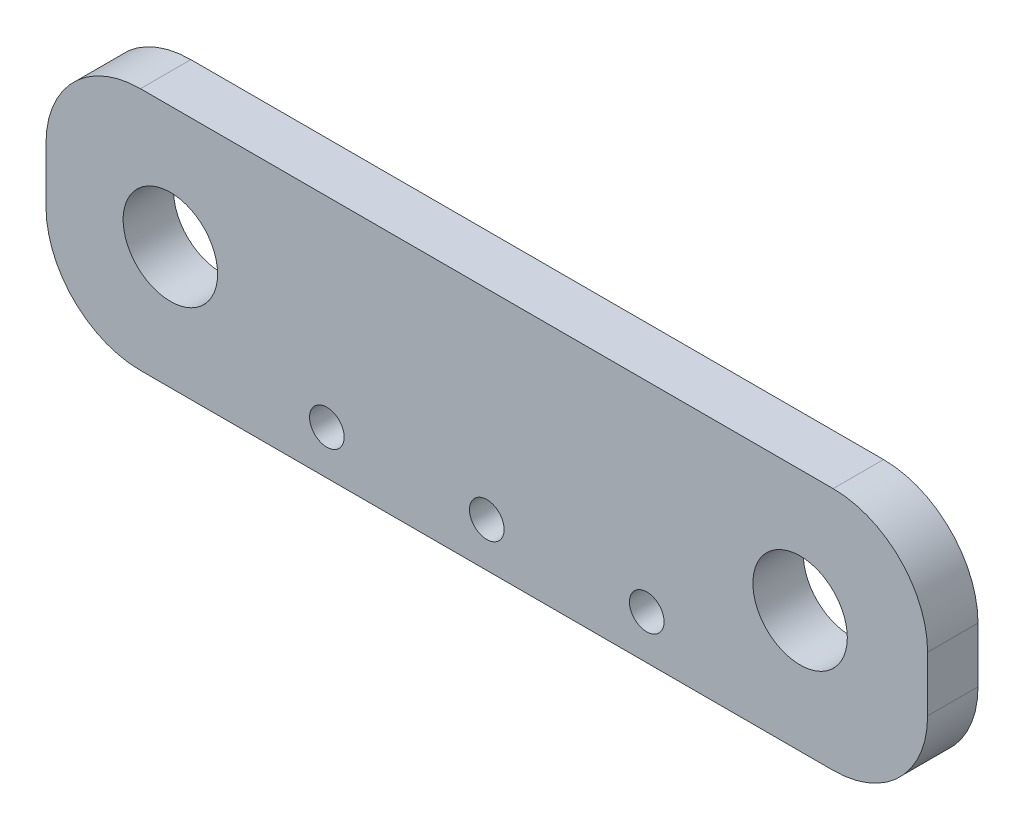
from build123d import *

# Parameters (mm, degrees)
SKETCH1_W           = 28
SKETCH1_H           = 7.75
BOSS_EXTRUDE1_DEPTH = 1.6
SKETCH2_R           = 1.5
CUT_EXTRUDE1_DEPTH  = 15.614226801
SKETCH3_R           = 0.55
CUT_EXTRUDE2_DEPTH  = 15.614226801
FILLET1_R           = 3


with BuildPart() as part:
    # Sketch1 → Boss-Extrude1 (new body)
    with BuildSketch(Plane.XY):
        Rectangle(SKETCH1_W, SKETCH1_H)
    extrude(amount=BOSS_EXTRUDE1_DEPTH)

    # Sketch2 → Cut-Extrude1 (cut, through all)
    with BuildSketch(Plane.XY.offset(1.6)):
        with Locations((-10.05, 0)):
            Circle(SKETCH2_R)
        with Locations((9.95, 0)):
            Circle(SKETCH2_R)
    extrude(amount=-CUT_EXTRUDE1_DEPTH, mode=Mode.SUBTRACT)

    # Sketch3 → Cut-Extrude2 (cut, through all)
    with BuildSketch(Plane.XY.offset(1.6)):
        with Locations((0, -2.475)):
            Circle(SKETCH3_R)
        with Locations((-5.08, -2.475)):
            Circle(SKETCH3_R)
        with Locations((5.08, -2.475)):
            Circle(SKETCH3_R)
    extrude(amount=-CUT_EXTRUDE2_DEPTH, mode=Mode.SUBTRACT)

    # Fillet1
    fillet1_edges = [part.edges().sort_by_distance(p)[0] for p in [
        (14, 3.875, 0.8),
        (14, -3.875, 0.8),
        (-14, 3.875, 0.8),
        (-14, -3.875, 0.8),
    ]]
    fillet(fillet1_edges, radius=FILLET1_R)


solid = part.part
